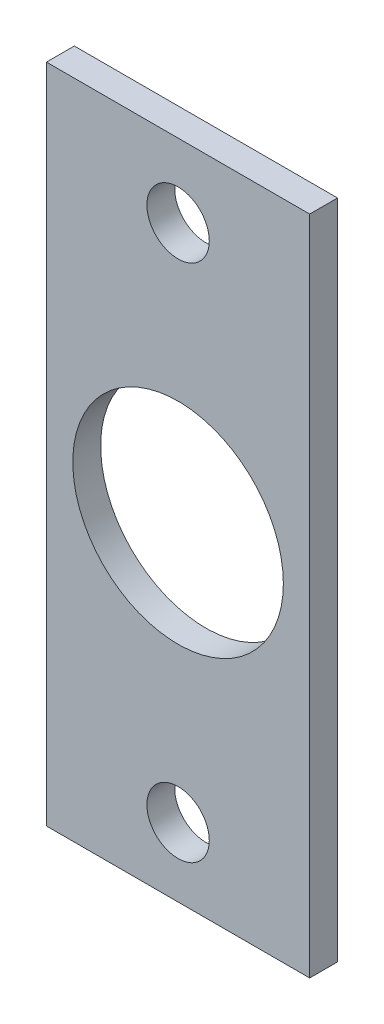
from build123d import *

# Parameters (mm, degrees)
SKETCH1_W           = 101.6
SKETCH1_H           = 101.6
BOSS_EXTRUDE1_DEPTH = 1.5875
SKETCH2_R           = 5.999999938
CUT_EXTRUDE1_DEPTH  = 190.018384556
SKETCH4_R           = 1.778
CUT_EXTRUDE2_DEPTH  = 190.018384556
SKETCH5_W           = 43.3
SKETCH5_H           = 101.6
CUT_EXTRUDE4_DEPTH  = 190.018384556
SKETCH10_W          = 15
SKETCH10_H          = 31.816690228
SKETCH10_H_2        = 32.081483739
CUT_EXTRUDE5_DEPTH  = 155.410769427


with BuildPart() as part:
    # Sketch1 → Boss-Extrude1 (new body)
    with BuildSketch(Plane.XY):
        with Locations((-108.093233083, 51.563909774)):
            Rectangle(SKETCH1_W, SKETCH1_H)
    extrude(amount=BOSS_EXTRUDE1_DEPTH)

    # Sketch2 → Cut-Extrude1 (cut, through all)
    with BuildSketch(Plane.XY.offset(1.5875)):
        with Locations((-108.093233083, 51.563909774)):
            Circle(SKETCH2_R)
    extrude(amount=-CUT_EXTRUDE1_DEPTH, mode=Mode.SUBTRACT)

    # Sketch4 → Cut-Extrude2 (cut, through all)
    with BuildSketch(Plane.XY.offset(1.5875)):
        with Locations((-108.093233083, 66.360241624)):
            Circle(SKETCH4_R)
        with Locations((-108.093233083, 36.767577924)):
            Circle(SKETCH4_R)
    extrude(amount=-CUT_EXTRUDE2_DEPTH, mode=Mode.SUBTRACT)

    # Sketch5 → Cut-Extrude4 (cut, through all)
    with BuildSketch(Plane.XY.offset(1.5875)):
        with Locations((-137.243233083, 51.563909774)):
            Rectangle(SKETCH5_W, SKETCH5_H)
        with Locations((-78.943233083, 51.563909774)):
            Rectangle(SKETCH5_W, SKETCH5_H)
    extrude(amount=-CUT_EXTRUDE4_DEPTH, mode=Mode.SUBTRACT)

    # Sketch10 → Cut-Extrude5 (cut, through all)
    with BuildSketch(Plane.XY.offset(1.5875)):
        with Locations((-108.093233083, 86.45556466)):
            Rectangle(SKETCH10_W, SKETCH10_H)
        with Locations((-108.093233083, 16.804651644)):
            Rectangle(SKETCH10_W, SKETCH10_H_2)
    extrude(amount=-CUT_EXTRUDE5_DEPTH, mode=Mode.SUBTRACT)


solid = part.part
